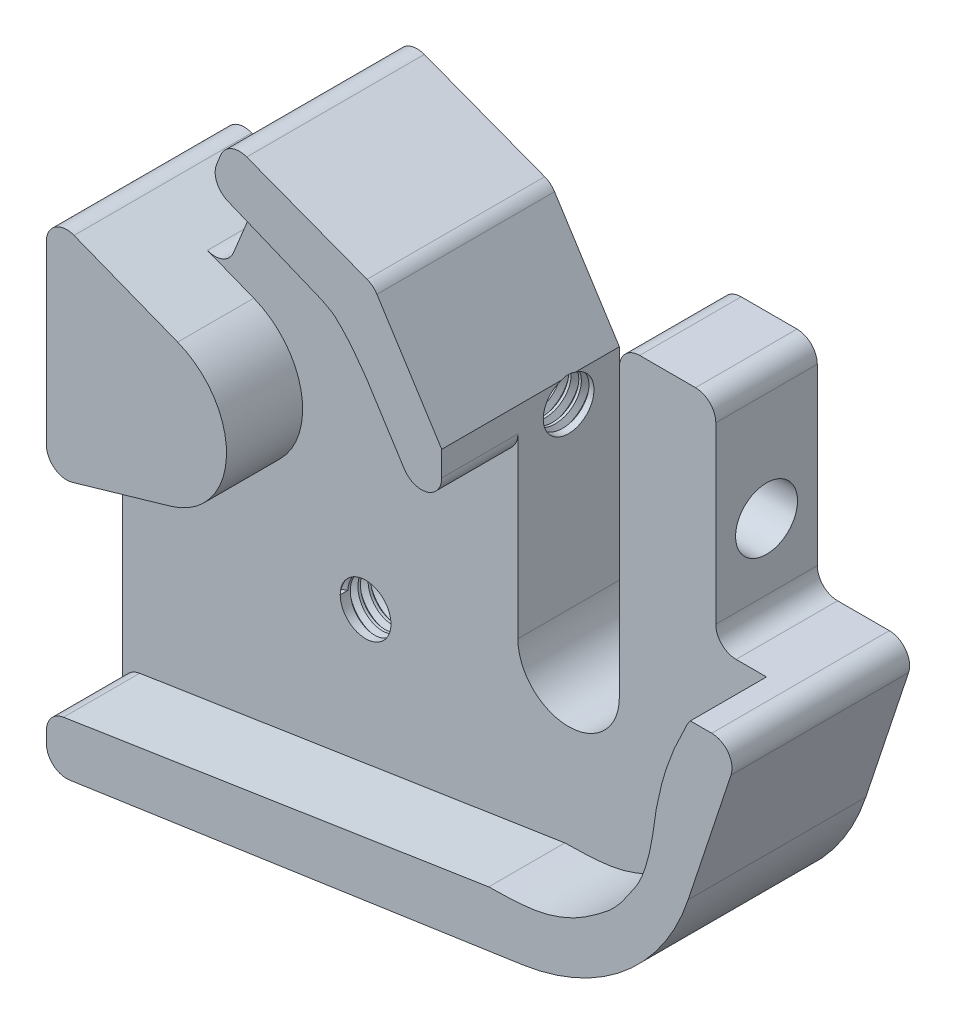
from build123d import *

# Parameters (mm, degrees)
BOSS_EXTRUDE1_DEPTH             = 10
SKETCH1_3_R                     = 7.578000113984699
BOSS_EXTRUDE2_DEPTH             = 17.5
FILLET1_R                       = 2
SKETCH4_R                       = 3.049999999999998
CUT_EXTRUDE2_DEPTH              = 30
TAP_DRILL_FOR_M6X1_0_TAP3_D     = 5
TAP_DRILL_FOR_M6X1_0_TAP3_DEPTH = 30
TAP_DRILL_FOR_M6X1_0_TAP3_TIP   = 1.5021515475689007
THREAD2_PITCH                   = 1
TAP_DRILL_FOR_M6X1_0_TAP4_D     = 5
TAP_DRILL_FOR_M6X1_0_TAP4_DEPTH = 30
TAP_DRILL_FOR_M6X1_0_TAP4_TIP   = 1.5021515475689007
THREAD3_PITCH                   = 1


with BuildPart() as part:
    # Sketch1 → Boss-Extrude1 (new body)
    with BuildSketch(Plane.XY):
        with BuildLine():
            Line((78.96827475522947, 38.5935556342534), (78.96827475522947, 42.187825253742076))
            Line((78.96827475522947, 42.187825253742076), (77.94135898527813, 43.80236991179886))
            Line((77.94135898527813, 43.80236991179886), (74.33675739276399, 49.46962171171273))
            ThreePointArc((74.33675739276399, 49.469621711712726), (63.688772453091616, 32.62392036907067), (72.5745325100122, 14.785744867864917))
            Line((72.5745325100123, 14.785744867865446), (83.59996436724236, 16.48818112450211))
            add(Edge.make_bspline(
                [(83.59996436724236, 16.48818112450211), (85.41724211796233, 16.537565687608662), (87.87798883539782, 16.519220276594933), (90.67264688620303, 17.420541267562605), (92.3949091726052, 18.177313617681204), (94.0998215997774, 19.33727905205282), (95.7619053250226, 20.5841697393974), (96.838108800911, 21.893388892292066), (97.57220809756224, 23.02149502182195), (98.29934242138772, 24.012698516640825), (98.8168110615546, 25.180735972728456), (99.338171414632, 26.794771591669818), (99.75451745291461, 28.73305881299976), (99.97921580397461, 30.878234339552694), (100.41119186805447, 32.8730475280245), (100.84339117053995, 34.69276986008277), (101.41680498340375, 36.208847575811006), (101.85717784527549, 37.44613777913256), (102.35269954460531, 38.403633859479754), (102.6382552105465, 39.04344915294926), (102.75433193083813, 39.3009495455537)],
                knots=[0, 0, 0, 0, 0.15768366072338366, 0.20676134981541355, 0.2516981863893839, 0.31900050382694334, 0.38365759589069376, 0.42951420214431174, 0.46378751400899093, 0.4995429911697522, 0.5348783172354219, 0.5730312186558052, 0.6454047552386061, 0.7048490244263054, 0.7583603601988523, 0.8208523578081605, 0.8654225677826217, 0.8976768321542437, 0.9336890739628735, 0.9579711653352317, 0.9579711653352317, 0.9579711653352317, 0.9579711653352317], degree=3))
            ThreePointArc((102.75433193083765, 39.30094954555368), (102.4765938343829, 39.94591996858493), (102.17672020405834, 40.5809011514899))
            Line((102.17672020405828, 40.58090115148971), (98.46827475522947, 40.58090115148971))
            Line((98.46827475522947, 40.58090115148971), (98.46827475522947, 45.80868367128349))
            ThreePointArc((98.46827475522967, 45.80868367128356), (94.09398060149493, 49.19440635869487), (88.96827475522964, 51.273999356618106))
            Line((88.96827475522946, 51.27399935661806), (88.96827475522946, 43.59355563425329))
            Line((88.96827475522946, 43.59355563425329), (88.96827475522946, 38.59355563425329))
            Line((88.96827475522946, 38.59355563425329), (88.96827475522947, 31.5935556342533))
            Line((88.96827475522947, 31.5935556342533), (88.96827475522947, 26.59355563425329))
            Line((88.96827475522947, 26.59355563425329), (83.96827475522934, 26.59355563425329))
            Line((83.96827475522934, 26.59355563425329), (78.96827475522947, 26.59355563425329))
            Line((78.96827475522947, 26.59355563425329), (78.96827475522947, 31.5935556342533))
            Line((78.96827475522947, 31.5935556342533), (78.96827475522947, 38.5935556342534))
        make_face()
        with BuildLine():
            Line((88.96827475522947, 61.76545821531718), (88.96827475522946, 51.27399935661806))
            ThreePointArc((88.96827475522964, 51.273999356618106), (94.09398060149493, 49.19440635869487), (98.46827475522967, 45.80868367128356))
            Line((98.46827475522947, 45.80868367128349), (98.46827475522947, 48.738746542251306))
            ThreePointArc((98.4682747552292, 48.73874654225122), (95.87453273292697, 54.3654582153173), (98.46827475522939, 59.99216988838329))
            Line((98.46827475522947, 59.99216988838326), (98.46827475522947, 61.76545821531719))
            Line((98.46827475522947, 61.76545821531719), (88.96827475522947, 61.76545821531718))
        make_face()
        with BuildLine():
            Line((88.96827475522947, 26.59355563425329), (88.96827475522947, 31.5935556342533))
            ThreePointArc((88.96827475522946, 31.5935556342533), (87.50380866116215, 28.058021728320522), (83.96827475522934, 26.59355563425331))
            Line((83.96827475522934, 26.59355563425329), (88.96827475522947, 26.59355563425329))
        make_face()
        with BuildLine():
            ThreePointArc((83.96827475522934, 26.59355563425331), (80.43274084929669, 28.058021728320615), (78.96827475522949, 31.5935556342533))
            Line((78.96827475522947, 31.5935556342533), (78.96827475522947, 26.59355563425329))
            Line((78.96827475522947, 26.59355563425329), (83.96827475522934, 26.59355563425329))
        make_face()
        with BuildLine():
            ThreePointArc((72.5745325100122, 14.785744867864917), (63.688772453091616, 32.62392036907067), (74.33675739276399, 49.469621711712726))
            Line((74.33675739276399, 49.46962171171273), (71.54074542683735, 53.865587102003296))
            add(Edge.make_bspline(
                [(67.16681294608784, 58.3330475317527), (67.53066578937491, 58.14815845494029), (68.2162670427706, 57.82971775359928), (69.7375428076036, 56.33759113466664), (70.7671129056723, 54.99803586851411), (71.54074542683735, 53.865587102003296)],
                knots=[0, 0, 0, 0, 0.19417637174294056, 0.35338295041403034, 1, 1, 1, 1], degree=3))
            Line((67.16681294608784, 58.3330475317527), (56.03811631838445, 62.90331689854259))
            Line((56.03811631838445, 62.90331689854259), (50.21233359803197, 48.7174203330503))
            Line((50.21233359803197, 48.7174203330503), (52.95464713088683, 47.643030748312306))
            ThreePointArc((52.95464713088681, 47.64303074831224), (56.45026737101809, 44.85792603920894), (57.76830437309072, 40.58721795212874))
            ThreePointArc((57.76830437309072, 40.58721795212874), (56.24935802543311, 36.03595953446999), (52.30143900683574, 33.30922401118043))
            Line((52.30143900683574, 33.30922401118043), (40.01978708427511, 29.746673468318164))
            Line((40.019787084275116, 29.746673468318164), (40.019787084275116, 9.758968623993628))
            Line((40.019787084275116, 9.758968623993628), (72.5745325100123, 14.785744867865446))
        make_face()
        with BuildLine():
            ThreePointArc((98.46827475522939, 59.99216988838329), (95.87453273292697, 54.3654582153173), (98.4682747552292, 48.73874654225122))
            Line((98.46827475522947, 48.738746542251306), (98.46827475522947, 59.99216988838326))
        make_face()
        with BuildLine():
            Line((103.46354532841673, 40.58090115148971), (102.17672020405828, 40.58090115148971))
            ThreePointArc((102.17672020405834, 40.5809011514899), (102.4765938343829, 39.94591996858493), (102.75433193083765, 39.30094954555368))
            add(Edge.make_bspline(
                [(102.75433193083813, 39.3009495455537), (102.75897264404554, 39.311244335670686), (102.95995934230356, 39.756929014093686), (103.16502264568484, 40.201773447042875), (103.46354532841673, 40.58090115148971)],
                knots=[0.9579711653352317, 0.9579711653352317, 0.9579711653352317, 0.9579711653352317, 0.9589419562212246, 1, 1, 1, 1], degree=3))
        make_face()
    extrude(amount=BOSS_EXTRUDE1_DEPTH)

    # Sketch1<3> → Boss-Extrude2 (add)
    with BuildSketch(Plane.XY):
        with BuildLine():
            ThreePointArc((74.33675739276399, 49.469621711712726), (76.59709644010309, 50.514062904297106), (78.96827475522967, 51.27399935661819))
            Line((78.96827475522947, 51.27399935661824), (78.96827475522947, 51.504339637287444))
            Line((78.96827475522947, 51.504339637287444), (77.99321410117432, 53.03735628417434))
            Line((77.99321410117432, 53.03735628417434), (72.23104068023561, 62.09680067854197))
            Line((72.2310406802356, 62.09680067854197), (70.50082285395956, 62.75430218344684))
            Line((70.50082285395956, 62.75430218344684), (57.93755222306168, 67.52848103011922))
            Line((57.93755222306168, 67.52848103011922), (56.03811631838445, 62.90331689854259))
            Line((56.03811631838445, 62.90331689854259), (67.16681294608784, 58.3330475317527))
            add(Edge.make_bspline(
                [(67.16681294608784, 58.3330475317527), (67.53066578937491, 58.14815845494029), (68.2162670427706, 57.82971775359928), (69.7375428076036, 56.33759113466664), (70.7671129056723, 54.99803586851411), (71.54074542683735, 53.865587102003296)],
                knots=[0, 0, 0, 0, 0.19417637174294056, 0.35338295041403034, 1, 1, 1, 1], degree=3))
            Line((71.54074542683735, 53.865587102003296), (74.33675739276399, 49.46962171171273))
        make_face()
        with BuildLine():
            Line((78.96827475522947, 42.187825253742076), (78.96827475522947, 43.59355563425329))
            Line((78.96827475522947, 43.59355563425329), (78.96827475522947, 49.44154603091854))
            Line((78.96827475522947, 49.44154603091854), (78.96827475522947, 51.27399935661824))
            ThreePointArc((78.96827475522967, 51.27399935661819), (76.59709644010309, 50.514062904297106), (74.33675739276399, 49.469621711712726))
            Line((74.33675739276399, 49.46962171171273), (77.94135898527813, 43.80236991179886))
            Line((77.94135898527813, 43.80236991179886), (78.96827475522947, 42.187825253742076))
        make_face()
        with Locations((50.19030425910602, 40.58721795212874)):
            Circle(SKETCH1_3_R)
        with BuildLine():
            Line((52.95464713088683, 47.643030748312306), (50.21233359803197, 48.7174203330503))
            Line((50.21233359803197, 48.7174203330503), (40.01978708427513, 52.710678465331654))
            Line((40.01978708427513, 52.71067846533165), (40.01978708427513, 47.34063824296787))
            Line((40.01978708427513, 47.34063824296787), (44.49575262392416, 45.58703468895018))
            ThreePointArc((44.49575262392417, 45.58703468895018), (48.4005247200828, 47.95082949329833), (52.95464713088681, 47.64303074831224))
        make_face()
        with BuildLine():
            Line((40.01978708427513, 47.34063824296787), (40.019787084275116, 35.746673468318164))
            Line((40.01978708427511, 35.74667346831816), (43.63005434703988, 36.79390715299979))
            ThreePointArc((43.63005434703988, 36.79390715299979), (42.648765078906784, 41.32969523869845), (44.49575262392417, 45.58703468895018))
            Line((44.49575262392416, 45.58703468895018), (40.01978708427513, 47.34063824296787))
        make_face()
        with BuildLine():
            Line((40.019787084275116, 35.746673468318164), (40.019787084275116, 29.746673468318164))
            Line((40.01978708427511, 29.746673468318164), (52.30143900683574, 33.30922401118043))
            ThreePointArc((52.30143900683574, 33.30922401118043), (47.364634323302816, 33.55574050130448), (43.63005434703988, 36.79390715299979))
            Line((43.63005434703988, 36.79390715299979), (40.01978708427511, 35.74667346831816))
        make_face()
        with BuildLine():
            ThreePointArc((86.91969219864855, 11.50353323048651), (79.43931899005581, 11.799404357013096), (72.5745325100122, 14.785744867864917))
            Line((72.5745325100123, 14.785744867865446), (40.019787084275116, 9.758968623993628))
            Line((40.019787084275116, 9.758968623993628), (40.019787084275116, 4.613486235158945))
            Line((40.019787084275116, 4.6134862351589465), (86.91969219864855, 11.50353323048651))
        make_face()
        with BuildLine():
            Line((83.59996436724236, 16.48818112450211), (72.5745325100123, 14.785744867865446))
            ThreePointArc((72.5745325100122, 14.785744867864917), (79.43931899005581, 11.799404357013096), (86.91969219864855, 11.50353323048651))
            ThreePointArc((86.91969219864855, 11.50353323048651), (97.02458405219978, 16.041943092429335), (103.24393055814997, 25.208498197040438))
            ThreePointArc((103.24393055814997, 25.208498197040438), (104.01478063177572, 28.35975489042779), (104.27393566811703, 31.593555634253295))
            ThreePointArc((104.27393566811703, 31.5935556342533), (103.89041284338643, 35.52144044742895), (102.75433193083765, 39.30094954555368))
            add(Edge.make_bspline(
                [(83.59996436724236, 16.48818112450211), (85.41724211796233, 16.537565687608662), (87.87798883539782, 16.519220276594933), (90.67264688620303, 17.420541267562605), (92.3949091726052, 18.177313617681204), (94.0998215997774, 19.33727905205282), (95.7619053250226, 20.5841697393974), (96.838108800911, 21.893388892292066), (97.57220809756224, 23.02149502182195), (98.29934242138772, 24.012698516640825), (98.8168110615546, 25.180735972728456), (99.338171414632, 26.794771591669818), (99.75451745291461, 28.73305881299976), (99.97921580397461, 30.878234339552694), (100.41119186805447, 32.8730475280245), (100.84339117053995, 34.69276986008277), (101.41680498340375, 36.208847575811006), (101.85717784527549, 37.44613777913256), (102.35269954460531, 38.403633859479754), (102.6382552105465, 39.04344915294926), (102.75433193083813, 39.3009495455537)],
                knots=[0, 0, 0, 0, 0.15768366072338366, 0.20676134981541355, 0.2516981863893839, 0.31900050382694334, 0.38365759589069376, 0.42951420214431174, 0.46378751400899093, 0.4995429911697522, 0.5348783172354219, 0.5730312186558052, 0.6454047552386061, 0.7048490244263054, 0.7583603601988523, 0.8208523578081605, 0.8654225677826217, 0.8976768321542437, 0.9336890739628735, 0.9579711653352317, 0.9579711653352317, 0.9579711653352317, 0.9579711653352317], degree=3))
        make_face()
        with BuildLine():
            Line((108.33603780990366, 40.58090115148971), (103.46354532841673, 40.58090115148971))
            add(Edge.make_bspline(
                [(102.75433193083813, 39.3009495455537), (102.75897264404554, 39.311244335670686), (102.95995934230356, 39.756929014093686), (103.16502264568484, 40.201773447042875), (103.46354532841673, 40.58090115148971)],
                knots=[0.9579711653352317, 0.9579711653352317, 0.9579711653352317, 0.9579711653352317, 0.9589419562212246, 1, 1, 1, 1], degree=3))
            ThreePointArc((102.75433193083765, 39.30094954555368), (103.89041284338643, 35.52144044742895), (104.27393566811703, 31.5935556342533))
            ThreePointArc((104.27393566811703, 31.593555634253295), (104.01478063177572, 28.35975489042779), (103.24393055814997, 25.208498197040438))
            Line((103.24393055815005, 25.208498197040413), (108.33603780990366, 40.58090115148971))
        make_face()
    extrude(amount=BOSS_EXTRUDE2_DEPTH)

    # Fillet1
    fillet1_edges = [part.edges().sort_by_distance(p)[0] for p in [
        (108.33603780990366, 40.58090115148971, 8.75),
        (98.46827475522947, 61.76545821531719, 5),
        (88.96827475522947, 61.76545821531718, 5),
        (57.93755222306168, 67.52848103011922, 8.75),
        (56.03811631838445, 62.90331689854259, 13.75),
        (78.96827475522947, 42.187825253742076, 13.75),
        (50.21233359803197, 48.7174203330503, 5),
        (98.46827475522947, 40.58090115148971, 5),
        (40.019787084275116, 4.613486235158946, 8.75),
        (40.019787084275116, 9.758968623993628, 13.75),
        (40.01978708427511, 29.746673468318164, 13.75),
        (40.01978708427513, 52.710678465331654, 8.75),
        (72.2310406802356, 62.09680067854197, 8.75),
    ]]
    fillet(fillet1_edges, radius=FILLET1_R)

    # Sketch4 → Cut-Extrude2 (cut)
    with BuildSketch(Plane.ZY.offset(-88.96827475522943)):
        with Locations((5, 49.09355563425338)):
            Circle(SKETCH4_R)
    extrude(amount=-CUT_EXTRUDE2_DEPTH, mode=Mode.SUBTRACT)

    # Tap Drill for M6x1.0 Tap3
    with Locations(Plane(origin=(88.968274755, 49.093555634, 5), x_dir=(0, 1, 0), z_dir=(1, 0, 0))):
        with Locations((0, 0)):
            Hole(TAP_DRILL_FOR_M6X1_0_TAP3_D / 2, depth=TAP_DRILL_FOR_M6X1_0_TAP3_DEPTH)
            with Locations((0, 0, -(TAP_DRILL_FOR_M6X1_0_TAP3_DEPTH + TAP_DRILL_FOR_M6X1_0_TAP3_TIP / 2))):  # 118° drill point
                Cone(0, TAP_DRILL_FOR_M6X1_0_TAP3_D / 2, TAP_DRILL_FOR_M6X1_0_TAP3_TIP, mode=Mode.SUBTRACT)

    # Thread2: the profile of Thread Profile2 profile screwed along a right-hand helix of 20 turns, 8 arcs to a turn; built about Z, then put on its axis
    thread2_z = Axis((0, 0, 0), (0, 0, 1))
    thread2_corners = [(2.4997, 0, -0.000173205), (3.041265875, 0, 0.312499998), (3.041265875, 0, 0.437499998), (2.4997, 0, 0.750173202)]
    with BuildLine(mode=Mode.PRIVATE) as thread2_profile:
        Line(thread2_corners[0], thread2_corners[1])
        Line(thread2_corners[1], thread2_corners[2])
        Line(thread2_corners[2], thread2_corners[3])
        Line(thread2_corners[3], thread2_corners[0])
    thread2_cap = Face(thread2_profile.wire())
    thread2_turn_angles = [0, 22.5, 45, 67.5, 90, 112.5, 135, 157.5, 180, 202.5, 225, 247.5, 270, 292.5, 315, 337.5, 360]
    thread2_turn_weights = [1, 0.9238795325112867, 1, 0.9238795325112867, 1, 0.9238795325112867, 1, 0.9238795325112867, 1, 0.9238795325112867, 1, 0.9238795325112867, 1, 0.9238795325112867, 1, 0.9238795325112867, 1]
    thread2_turn_rails = [Edge.make_bspline([Vector(p[0], p[1], 0).rotate(thread2_z, thread2_turn_angles[k]) / thread2_turn_weights[k] + Vector(0, 0, p[2] + THREAD2_PITCH * thread2_turn_angles[k] / 360) for k in range(17)], [0, 0, 0, 1, 1, 2, 2, 3, 3, 4, 4, 5, 5, 6, 6, 7, 7, 8, 8, 8], 2, thread2_turn_weights) for p in thread2_corners]
    thread2_turn_sides = [Face.make_surface_from_curves(thread2_turn_rails[p[0]], thread2_turn_rails[p[1]]) for p in [(0, 1), (1, 2), (2, 3), (3, 0)]]
    thread2 = Plane(origin=(78.968274755, 49.093555634, 5), x_dir=(0, 0, 1), z_dir=(-1, 0, 0)) * Solid(Shell([*[p.moved(Location((0, 0, THREAD2_PITCH * i))) for i in range(20) for p in thread2_turn_sides], thread2_cap, thread2_cap.rotate(thread2_z, 7200).moved(Location((0, 0, THREAD2_PITCH * 7200 / 360)))]))
    add(thread2, mode=Mode.SUBTRACT)

    # Tap Drill for M6x1.0 Tap4
    with Locations(Plane(origin=(63.968274755, 26.593555634, 10), x_dir=(1, 0, 0), z_dir=(0, 0, 1))):
        with Locations((0, 0)):
            Hole(TAP_DRILL_FOR_M6X1_0_TAP4_D / 2, depth=TAP_DRILL_FOR_M6X1_0_TAP4_DEPTH)
            with Locations((0, 0, -(TAP_DRILL_FOR_M6X1_0_TAP4_DEPTH + TAP_DRILL_FOR_M6X1_0_TAP4_TIP / 2))):  # 118° drill point
                Cone(0, TAP_DRILL_FOR_M6X1_0_TAP4_D / 2, TAP_DRILL_FOR_M6X1_0_TAP4_TIP, mode=Mode.SUBTRACT)

    # Thread3: the profile of Thread Profile3 profile screwed along a right-hand helix of 20 turns, 8 arcs to a turn; built about Z, then put on its axis
    thread3_z = Axis((0, 0, 0), (0, 0, 1))
    thread3_corners = [(2.4997, 0, -0.000173205), (3.041265875, 0, 0.312499999), (3.041265875, 0, 0.437499999), (2.4997, 0, 0.750173202)]
    with BuildLine(mode=Mode.PRIVATE) as thread3_profile:
        Line(thread3_corners[0], thread3_corners[1])
        Line(thread3_corners[1], thread3_corners[2])
        Line(thread3_corners[2], thread3_corners[3])
        Line(thread3_corners[3], thread3_corners[0])
    thread3_cap = Face(thread3_profile.wire())
    thread3_turn_angles = [0, 22.5, 45, 67.5, 90, 112.5, 135, 157.5, 180, 202.5, 225, 247.5, 270, 292.5, 315, 337.5, 360]
    thread3_turn_weights = [1, 0.9238795325112867, 1, 0.9238795325112867, 1, 0.9238795325112867, 1, 0.9238795325112867, 1, 0.9238795325112867, 1, 0.9238795325112867, 1, 0.9238795325112867, 1, 0.9238795325112867, 1]
    thread3_turn_rails = [Edge.make_bspline([Vector(p[0], p[1], 0).rotate(thread3_z, thread3_turn_angles[k]) / thread3_turn_weights[k] + Vector(0, 0, p[2] + THREAD3_PITCH * thread3_turn_angles[k] / 360) for k in range(17)], [0, 0, 0, 1, 1, 2, 2, 3, 3, 4, 4, 5, 5, 6, 6, 7, 7, 8, 8, 8], 2, thread3_turn_weights) for p in thread3_corners]
    thread3_turn_sides = [Face.make_surface_from_curves(thread3_turn_rails[p[0]], thread3_turn_rails[p[1]]) for p in [(0, 1), (1, 2), (2, 3), (3, 0)]]
    thread3 = Plane(origin=(63.968274755, 26.593555634, 10), x_dir=(-1, 0, 0), z_dir=(0, 0, -1)) * Solid(Shell([*[p.moved(Location((0, 0, THREAD3_PITCH * i))) for i in range(20) for p in thread3_turn_sides], thread3_cap, thread3_cap.rotate(thread3_z, 7200).moved(Location((0, 0, THREAD3_PITCH * 7200 / 360)))]))
    add(thread3, mode=Mode.SUBTRACT)


solid = part.part
